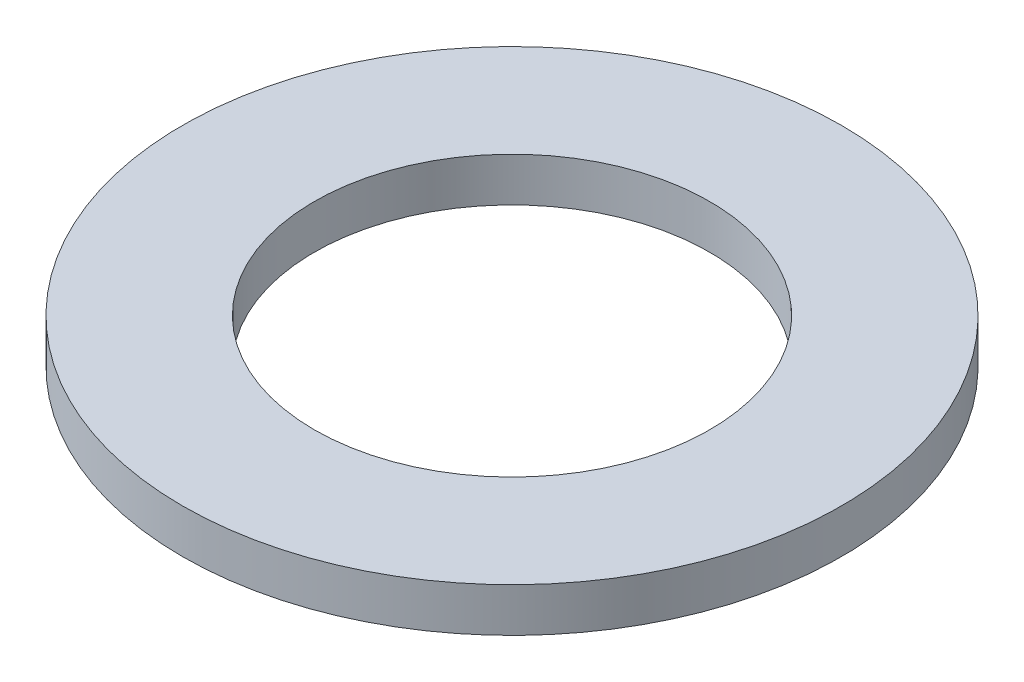
from build123d import *

# Parameters (mm, degrees)
SKETCH1_R           = 75
BOSS_EXTRUDE1_DEPTH = 10
SKETCH2_R           = 45
CUT_EXTRUDE1_DEPTH  = 107.536378763


with BuildPart() as part:
    # Sketch1 → Boss-Extrude1 (new body)
    with BuildSketch(Plane(origin=(0, 0, 0), x_dir=(1, 0, 0), z_dir=(0, 1, 0))):
        Circle(SKETCH1_R)
    extrude(amount=BOSS_EXTRUDE1_DEPTH)

    # Sketch2 → Cut-Extrude1 (cut, through all)
    with BuildSketch(Plane(origin=(0, 0, 0), x_dir=(1, 0, 0), z_dir=(0, 1, 0))):
        Circle(SKETCH2_R)
    extrude(amount=CUT_EXTRUDE1_DEPTH, mode=Mode.SUBTRACT)


solid = part.part
